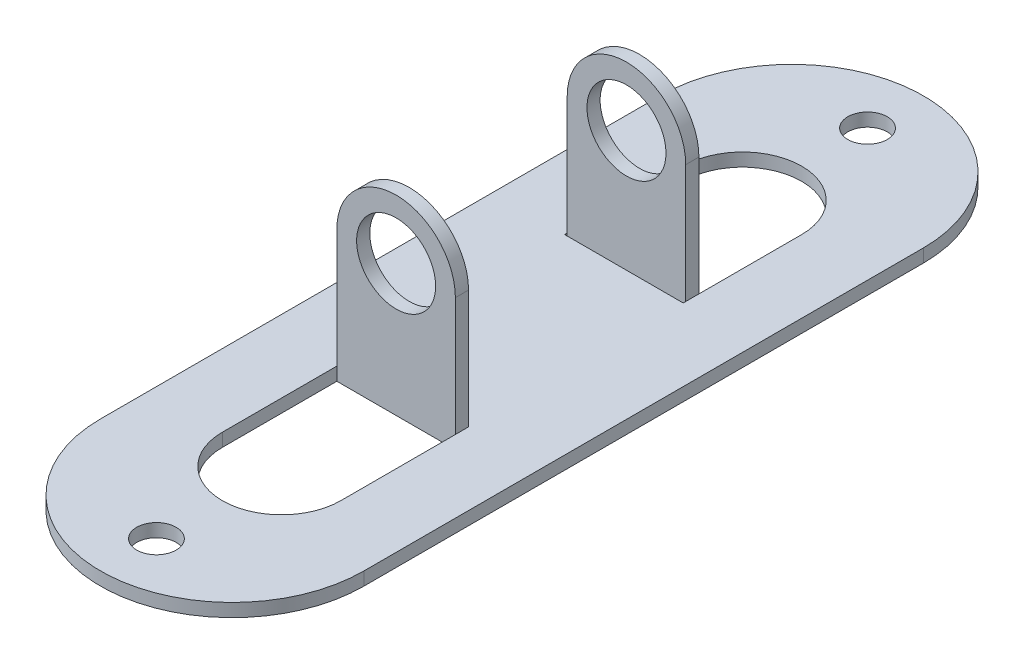
from build123d import *

# Parameters (mm, degrees)
BASE_FLANGE1_DEPTH  = 2
CUT_EXTRUDE13_DEPTH = 10
BOSS_EXTRUDE4_DEPTH = 2
BOSS_EXTRUDE5_START = -2
BOSS_EXTRUDE5_DEPTH = 2
SKETCH18_R          = 6
CUT_EXTRUDE14_DEPTH = 87.861941803
SKETCH19_R          = 3
CUT_EXTRUDE15_DEPTH = 86.495161894


# Sheet-metal steps are written as plain solids
with BuildPart() as part:
    # Sketch2 → Base-Flange1 (new body)
    with BuildSketch(Plane(origin=(0, 0, 0), x_dir=(1, 0, 0), z_dir=(0, 1, 0))):
        with BuildLine():
            Line((20, 27.099918438), (20, -57.900081562))
            ThreePointArc((20, -57.900081562), (0, -77.900081562), (-20, -57.900081562))
            Line((-20, -57.900081562), (-20, 27.099918438))
            ThreePointArc((-20, 27.099918438), (0, 47.099918438), (20, 27.099918438))
        make_face()
    extrude(amount=-BASE_FLANGE1_DEPTH)

    # Sketch9 → Cut-Extrude13 (cut)
    with BuildSketch(Plane(origin=(0, 0, 0), x_dir=(1, 0, 0), z_dir=(0, 1, 0))):
        with BuildLine():
            Line((9, 1.599918438), (-9, 1.599918438))
            Line((-9, 1.599918438), (-9, 19.599918438))
            ThreePointArc((-9, 19.599918438), (0, 28.599918438), (9, 19.599918438))
            Line((9, 19.599918438), (9, 1.599918438))
        make_face()
        with BuildLine():
            Line((-9, -32.400081562), (9, -32.400081562))
            Line((9, -32.400081562), (9, -50.400081562))
            ThreePointArc((9, -50.400081562), (0, -59.400081562), (-9, -50.400081562))
            Line((-9, -50.400081562), (-9, -32.400081562))
        make_face()
    extrude(amount=-CUT_EXTRUDE13_DEPTH, mode=Mode.SUBTRACT)

    # Sketch16 → Boss-Extrude4 (add)
    with BuildSketch(Plane.XY.offset(31)):
        with BuildLine():
            Line((-9, -2), (-9, 18))
            ThreePointArc((-9, 18), (0, 27), (9, 18))
            Line((9, 18), (9, -2))
            Line((9, -2), (-9, -2))
        make_face()
    extrude(amount=BOSS_EXTRUDE4_DEPTH)

    # Sketch17 → Boss-Extrude5 (add)
    with BuildSketch(Plane.XY.offset(-1.985).offset(BOSS_EXTRUDE5_START)):
        with BuildLine():
            Line((9, -2), (9, 18))
            ThreePointArc((9, 18), (0, 27), (-9, 18))
            Line((-9, 18), (-9, -2))
            Line((-9, -2), (9, -2))
        make_face()
    extrude(amount=BOSS_EXTRUDE5_DEPTH)

    # Sketch18 → Cut-Extrude14 (cut, through all)
    with BuildSketch(Plane.XY.offset(33)):
        with Locations((0, 18)):
            Circle(SKETCH18_R)
    extrude(amount=-CUT_EXTRUDE14_DEPTH, mode=Mode.SUBTRACT)

    # Sketch19 → Cut-Extrude15 (cut, through all)
    with BuildSketch(Plane.XZ.offset(2)):
        with Locations(Location((0, 69.400081562, 0), (0, 0, 270))):
            Circle(SKETCH19_R)
        with Locations(Location((0, -38.599918438, 0), (0, 0, 270))):
            Circle(SKETCH19_R)
    extrude(amount=-CUT_EXTRUDE15_DEPTH, mode=Mode.SUBTRACT)


solid = part.part
